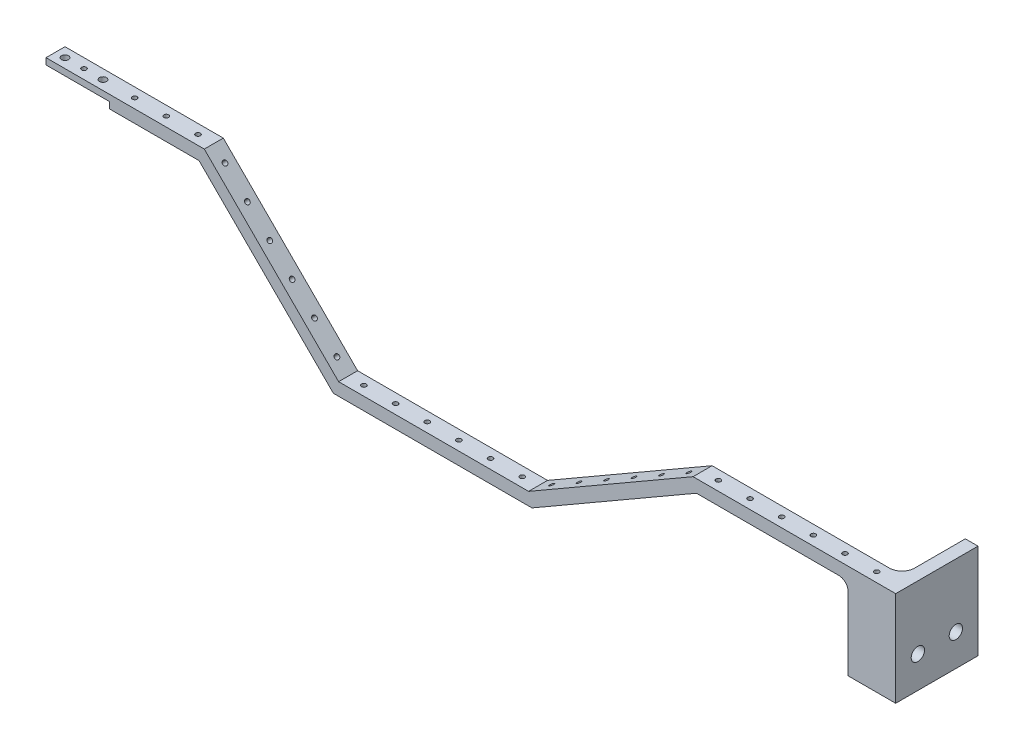
from build123d import *

# Parameters (mm, degrees)
BOSS_EXTRUDE1_DEPTH = 6
SKETCH2_W           = 20
SKETCH2_H           = 30
BOSS_EXTRUDE2_DEPTH = 4
SKETCH3_W           = 20
SKETCH3_H           = 2
CUT_EXTRUDE1_DEPTH  = 6
SKETCH4_R           = 0.75
CUT_EXTRUDE2_DEPTH  = 172.161563774
SKETCH5_R           = 0.75
CUT_EXTRUDE3_DEPTH  = 153.773797585
SKETCH6_R           = 0.75
CUT_EXTRUDE4_DEPTH  = 174.032600725
SKETCH7_R           = 0.75
CUT_EXTRUDE5_DEPTH  = 191.462831696
FILLET1_R           = 4
SKETCH8_W           = 15
SKETCH8_H           = 30
BOSS_EXTRUDE3_DEPTH = 2
FILLET2_R           = 3
FILLET3_START       = 4.0000001
FILLET3_DEPTH       = 1.9999999
FILLET3_START_2     = 148.554137986
FILLET3_2_DEPTH     = 3.0000001
FILLET3_START_3     = 0.9999999
FILLET3_3_DEPTH     = 3.00000019
SKETCH9_R           = 0.75
CUT_EXTRUDE6_DEPTH  = 12
SKETCH10_R          = 1.1
CUT_EXTRUDE7_DEPTH  = 12
SKETCH11_R          = 1.1
CUT_EXTRUDE8_DEPTH  = 12
SKETCH12_R          = 0.75
CUT_EXTRUDE9_DEPTH  = 12
SKETCH13_R          = 2.1
CUT_EXTRUDE10_DEPTH = 6
SKETCH14_R          = 2.1
CUT_EXTRUDE11_DEPTH = 6


with BuildPart() as part:
    # Sketch1 → Boss-Extrude1 (new body)
    with BuildSketch(Plane.XY):
        Polygon((166.554138086, -30.981559499), (166.554138086, -0.981559499), (102.554138086, -0.981559499), (50.592613859, -30.981559499), (-9.407386141, -30.981559499), (-51.833793012, 11.444847372), (-101.833793012, 11.444847372), (-101.833793012, 7.444847372), (-53.490647262, 7.444847372), (-11.06424039, -34.981559499), (51.664410629, -34.981559499), (103.625934856, -4.981559499), (162.554138086, -4.981559499), (162.554138086, -30.981559499), align=None)
    extrude(amount=BOSS_EXTRUDE1_DEPTH)

    # Sketch2 → Boss-Extrude2 (add)
    with BuildSketch(Plane(origin=(166.554138086, 0, 0), x_dir=(0, 0, -1), z_dir=(1, 0, 0))):
        with Locations((10, -15.981559499)):
            Rectangle(SKETCH2_W, SKETCH2_H)
    extrude(amount=-BOSS_EXTRUDE2_DEPTH)

    # Sketch3 → Cut-Extrude1 (cut)
    with BuildSketch(Plane.XY.offset(6)):
        with Locations((-91.833793012, 8.444847372)):
            Rectangle(SKETCH3_W, SKETCH3_H)
    extrude(amount=-CUT_EXTRUDE1_DEPTH, mode=Mode.SUBTRACT)

    # Sketch4 → Cut-Extrude2 (cut, through all)
    with BuildSketch(Plane(origin=(0, -0.981559499, 0), x_dir=(1, 0, 0), z_dir=(0, 1, 0))):
        with Locations(Location((107.554138086, -3, 0), (0, 0, 180))):
            Circle(SKETCH4_R)
        with Locations(Location((117.554138086, -3, 0), (0, 0, 180))):
            Circle(SKETCH4_R)
        with Locations(Location((127.554138086, -3, 0), (0, 0, 180))):
            Circle(SKETCH4_R)
        with Locations(Location((137.554138086, -3, 0), (0, 0, 180))):
            Circle(SKETCH4_R)
        with Locations(Location((147.554138086, -3, 0), (0, 0, 180))):
            Circle(SKETCH4_R)
        with Locations(Location((157.554138086, -3, 0), (0, 0, 180))):
            Circle(SKETCH4_R)
    extrude(amount=-CUT_EXTRUDE2_DEPTH, mode=Mode.SUBTRACT)

    # Sketch5 → Cut-Extrude3 (cut, through all)
    with BuildSketch(Plane(origin=(26.063562252, -45.143414047, 0), x_dir=(0.8660254037844379, 0.5000000000000013, 0), z_dir=(-0.5000000000000013, 0.8660254037844379, 0))):
        with Locations(Location((33.323709096, -3, 0), (0, 0, 180))):
            Circle(SKETCH5_R)
        with Locations(Location((43.323709096, -3, 0), (0, 0, 180))):
            Circle(SKETCH5_R)
        with Locations(Location((53.323709096, -3, 0), (0, 0, 180))):
            Circle(SKETCH5_R)
        with Locations(Location((63.323709096, -3, 0), (0, 0, 180))):
            Circle(SKETCH5_R)
        with Locations(Location((73.323709096, -3, 0), (0, 0, 180))):
            Circle(SKETCH5_R)
        with Locations(Location((83.323709096, -3, 0), (0, 0, 180))):
            Circle(SKETCH5_R)
    extrude(amount=-CUT_EXTRUDE3_DEPTH, mode=Mode.SUBTRACT)

    # Sketch6 → Cut-Extrude4 (cut, through all)
    with BuildSketch(Plane(origin=(0, -30.981559499, 0), x_dir=(1, 0, 0), z_dir=(0, 1, 0))):
        with Locations(Location((45.592613859, -3, 0), (0, 0, 180))):
            Circle(SKETCH6_R)
        with Locations(Location((35.592613859, -3, 0), (0, 0, 180))):
            Circle(SKETCH6_R)
        with Locations(Location((25.592613859, -3, 0), (0, 0, 180))):
            Circle(SKETCH6_R)
        with Locations(Location((15.592613859, -3, 0), (0, 0, 180))):
            Circle(SKETCH6_R)
        with Locations(Location((5.592613859, -3, 0), (0, 0, 180))):
            Circle(SKETCH6_R)
        with Locations(Location((-4.407386141, -3, 0), (0, 0, 180))):
            Circle(SKETCH6_R)
    extrude(amount=-CUT_EXTRUDE4_DEPTH, mode=Mode.SUBTRACT)

    # Sketch7 → Cut-Extrude5 (cut, through all)
    with BuildSketch(Plane(origin=(-20.19447282, -20.19447282, 0), x_dir=(0, 0, -1), z_dir=(0.7071067811865487, 0.7071067811865464, 0))):
        with Locations(Location((-3, -10.25524428, 0), (0, 0, 90))):
            Circle(SKETCH7_R)
        with Locations(Location((-3, -0.25524428, 0), (0, 0, 90))):
            Circle(SKETCH7_R)
        with Locations(Location((-3, 9.74475572, 0), (0, 0, 90))):
            Circle(SKETCH7_R)
        with Locations(Location((-3, 19.74475572, 0), (0, 0, 90))):
            Circle(SKETCH7_R)
        with Locations(Location((-3, 29.74475572, 0), (0, 0, 90))):
            Circle(SKETCH7_R)
        with Locations(Location((-3, 39.74475572, 0), (0, 0, 90))):
            Circle(SKETCH7_R)
    extrude(amount=-CUT_EXTRUDE5_DEPTH, mode=Mode.SUBTRACT)

    # Fillet1
    fillet1_edges = [part.edges().sort_by_distance(p)[0] for p in [
        (162.554138086, -4.981559499, 3),
        (162.554138086, -2.981559499, 0),
    ]]
    fillet(fillet1_edges, radius=FILLET1_R)

    # Sketch8 → Boss-Extrude3 (add)
    with BuildSketch(Plane.XY.offset(6)):
        with Locations((159.054138086, -15.981559499)):
            Rectangle(SKETCH8_W, SKETCH8_H)
    extrude(amount=-BOSS_EXTRUDE3_DEPTH)

    # Fillet2
    # the kernel refuses this fillet: 3 mm, written as the material it adds along each edge
    with BuildSketch(Plane(origin=(158.554138086, -8.981559499, 4), x_dir=(1, 0, 0), z_dir=(0, -1, 0))) as fillet2_piece_1:
        with BuildLine():
            CenterArc((4 - FILLET2_R, -FILLET2_R), FILLET2_R, 0, 90)
            Line((4, -FILLET2_R), (4, 0))
            Line((4, 0), (4 - FILLET2_R, 0))
        make_face()
    revolve(axis=Axis((158.554138086, -8.981559499, 4), (0, 0, 1)), revolution_arc=90)
    with BuildSketch(Plane(origin=(151.554138086, -4.981559499, 4), x_dir=(0, -1, 0), z_dir=(1, 0, 0))) as fillet2_piece_2_section:
        with BuildLine():
            CenterArc((FILLET2_R, FILLET2_R), FILLET2_R, 180, 90)
            Line((0, FILLET2_R), (0, 0))
            Line((0, 0), (FILLET2_R, 0))
        make_face()
    fillet2_piece_2 = extrude(amount=7, mode=Mode.PRIVATE)
    fillet2_piece_2 = fillet2_piece_2 - Plane(origin=(157.554138086, -4.981559499, 3), x_dir=(-1, 0, 0), z_dir=(0, 1, 0)) * Cylinder(0.75, 27, mode=Mode.PRIVATE)
    add(fillet2_piece_2)
    with BuildSketch(Plane(origin=(162.554138086, -8.981559499, 4), x_dir=(0, 0, -1), z_dir=(0, -1, 0))) as fillet2_piece_3:
        with BuildLine():
            CenterArc((FILLET2_R, -FILLET2_R), FILLET2_R, 90, 90)
            Line((0, -FILLET2_R), (0, 0))
            Line((0, 0), (FILLET2_R, 0))
        make_face()
    extrude(amount=22)

    # Fillet3: read off the stored shape, not the designer's step
    # Fillet3 outline → Fillet3 (add)
    with BuildSketch(Plane.XY.offset(FILLET3_START)):
        with BuildLine():
            ThreePointArc((148.554138086, -4.981559499), (150.67545843, -5.860239155), (151.554138086, -7.981559499))
            Line((151.554138086, -7.981559499), (151.554138086, -4.981559499))
            Line((151.554138086, -4.981559499), (148.554138086, -4.981559499))
        make_face()
    extrude(amount=FILLET3_DEPTH)

    # Fillet3 2 outline → Fillet3 2 (add)
    with BuildSketch(Plane.YZ.offset(FILLET3_START_2)):
        with BuildLine():
            Line((-4.981559499, 4.0000001), (-7.981559499, 4))
            ThreePointArc((-7.981559499, 4), (-5.860239155, 3.121320344), (-4.981559499, 1))
            Line((-4.981559499, 1), (-4.981559499, 4.0000001))
        make_face()
    extrude(amount=FILLET3_2_DEPTH)

    # Fillet3 3 outline → Fillet3 3 (cut)
    with BuildSketch(Plane.XY.offset(FILLET3_START_3)):
        with BuildLine():
            Line((151.554138085, -9), (151.554138086, -7.981559499))
            ThreePointArc((151.554138086, -7.981559499), (150.67545843, -5.860239155), (148.554138086, -4.981559499))
            Line((148.554138086, -4.981559499), (148.554137986, -9))
            Line((148.554137986, -9), (151.554138085, -9))
        make_face()
    extrude(amount=FILLET3_3_DEPTH, mode=Mode.SUBTRACT)

    # Sketch9 → Cut-Extrude6 (cut)
    with BuildSketch(Plane(origin=(0, 11.444847372, 0), x_dir=(1, 0, 0), z_dir=(0, 1, 0))):
        with Locations(Location((-56.833793012, -3, 0), (0, 0, 180))):
            Circle(SKETCH9_R)
        with Locations(Location((-66.833793012, -3, 0), (0, 0, 180))):
            Circle(SKETCH9_R)
        with Locations(Location((-76.833793012, -3, 0), (0, 0, 180))):
            Circle(SKETCH9_R)
    extrude(amount=-CUT_EXTRUDE6_DEPTH, mode=Mode.SUBTRACT)

    # Sketch10 → Cut-Extrude7 (cut)
    with BuildSketch(Plane.XZ.offset(-9.444847372)):
        with Locations(Location((-98.833793012, 3, 0), (0, 0, 270))):
            Circle(SKETCH10_R)
    extrude(amount=-CUT_EXTRUDE7_DEPTH, mode=Mode.SUBTRACT)

    # Sketch11 → Cut-Extrude8 (cut)
    with BuildSketch(Plane.XZ.offset(-9.444847372)):
        with Locations(Location((-86.833793012, 3, 0), (0, 0, 270))):
            Circle(SKETCH11_R)
    extrude(amount=-CUT_EXTRUDE8_DEPTH, mode=Mode.SUBTRACT)

    # Sketch12 → Cut-Extrude9 (cut)
    with BuildSketch(Plane.XZ.offset(-9.444847372)):
        with Locations(Location((-92.833793012, 3, 0), (0, 0, 270))):
            Circle(SKETCH12_R)
    extrude(amount=-CUT_EXTRUDE9_DEPTH, mode=Mode.SUBTRACT)

    # Sketch13 → Cut-Extrude10 (cut)
    with BuildSketch(Plane(origin=(166.554138086, 0, 0), x_dir=(0, 0, -1), z_dir=(1, 0, 0))):
        with Locations(Location((1, -20.981559499, 0), (0, 0, 90))):
            Circle(SKETCH13_R)
    extrude(amount=-CUT_EXTRUDE10_DEPTH, mode=Mode.SUBTRACT)

    # Sketch14 → Cut-Extrude11 (cut)
    with BuildSketch(Plane(origin=(166.554138086, 0, 0), x_dir=(0, 0, -1), z_dir=(1, 0, 0))):
        with Locations(Location((13, -20.981559499, 0), (0, 0, 90))):
            Circle(SKETCH14_R)
    extrude(amount=-CUT_EXTRUDE11_DEPTH, mode=Mode.SUBTRACT)


solid = part.part
